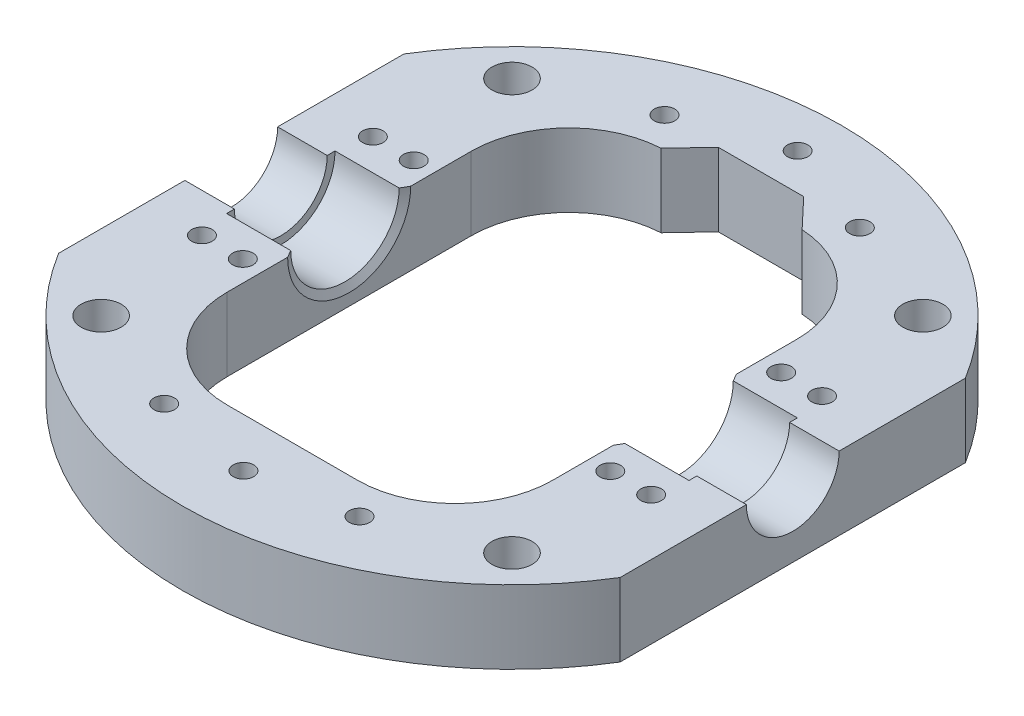
from build123d import *
from OCP.BRepFilletAPI import BRepFilletAPI_MakeChamfer

# Parameters (mm, degrees)
SKETCH2_R               = 67.5
SKETCH2_W               = 66.7
SKETCH2_H               = 90
BOSS_EXTRUDE1_DEPTH     = 15
SKETCH7_W               = 14
SKETCH7_H               = 11.1
CUT_EXTRUDE1_DEPTH      = 135.058839694
CUT_EXTRUDE1_DEPTH_BACK = 135.058839694
SKETCH8_R               = 9.5
FILLET1_R               = 20
SKETCH9_R               = 2.1
CUT_EXTRUDE2_DEPTH      = 97.630740606
CHAMFER1_SIZE           = 1.5
CHAMFER1_SIZE2          = 0.866025404
SKETCH10_R              = 4.1
CUT_EXTRUDE3_DEPTH      = 97.630740606
CUT_EXTRUDE4_DEPTH      = 97.630740606
SKETCH12_W              = 10
SKETCH12_H              = 6
CUT_EXTRUDE5_DEPTH      = 97.630740606
CHAMFER2_START          = -1
CHAMFER2_DEPTH          = 16
CUT_EXTRUDE6_DEPTH      = 97.630740606


with BuildPart() as part:
    # Sketch2 → Boss-Extrude1 (new body)
    with BuildSketch(Plane(origin=(0, 0, 0), x_dir=(1, 0, 0), z_dir=(0, 1, 0))):
        with Locations(Location((0, 0, 0), (0, 0, 270))):
            Circle(SKETCH2_R)
        Rectangle(SKETCH2_W, SKETCH2_H, mode=Mode.SUBTRACT)
    extrude(amount=BOSS_EXTRUDE1_DEPTH)

    # Sketch7 → Cut-Revolve2 (revolve, cut)
    with BuildSketch(Plane(origin=(0, 15, 0), x_dir=(1, 0, 0), z_dir=(0, 1, 0))):
        with Locations((-40.35, 5.55)):
            Rectangle(SKETCH7_W, SKETCH7_H)
        with Locations((40.35, 5.55)):
            Rectangle(SKETCH7_W, SKETCH7_H)
    revolve(axis=Axis((67.5, 15, 0), (-1, 0, 0)), mode=Mode.SUBTRACT)

    # Sketch8 → Cut-Extrude1 (cut, two sides: drawn at the far end of the back side and taken through both)
    with BuildSketch(Plane.ZY.offset(-47.35).offset(-CUT_EXTRUDE1_DEPTH_BACK)):
        with Locations((0, 15)):
            Circle(SKETCH8_R)
    extrude(amount=CUT_EXTRUDE1_DEPTH + CUT_EXTRUDE1_DEPTH_BACK, mode=Mode.SUBTRACT)

    # Fillet1
    fillet1_edges = [part.edges().sort_by_distance(p)[0] for p in [
        (-33.35, 7.5, -45),
        (-33.35, 7.5, 45),
        (33.35, 7.5, 45),
        (33.35, 7.5, -45),
    ]]
    fillet(fillet1_edges, radius=FILLET1_R)

    # Sketch9 → Cut-Extrude2 (cut, through all)
    with BuildSketch(Plane(origin=(0, 15, 0), x_dir=(1, 0, 0), z_dir=(0, 1, 0))):
        with Locations(Location((-37.629775444, 17.5, 0), (0, 0, 270))):
            Circle(SKETCH9_R)
        with Locations(Location((37.629775444, 17.5, 0), (0, 0, 270))):
            Circle(SKETCH9_R)
        with Locations(Location((37.629775444, -17.5, 0), (0, 0, 270))):
            Circle(SKETCH9_R)
        with Locations(Location((-37.629775444, -17.5, 0), (0, 0, 270))):
            Circle(SKETCH9_R)
        with Locations(Location((-20, 51.23475383, 0), (0, 0, 270))):
            Circle(SKETCH9_R)
        with Locations(Location((20, 51.23475383, 0), (0, 0, 270))):
            Circle(SKETCH9_R)
        with Locations(Location((20, -51.23475383, 0), (0, 0, 270))):
            Circle(SKETCH9_R)
        with Locations(Location((-20, -51.23475383, 0), (0, 0, 270))):
            Circle(SKETCH9_R)
        with Locations(Location((0, -55, 0), (0, 0, 270))):
            Circle(SKETCH9_R)
        with Locations(Location((0, 58.5, 0), (0, 0, 270))):
            Circle(SKETCH9_R)
        with Locations(Location((-46, 17.5, 0), (0, 0, 270))):
            Circle(SKETCH9_R)
        with Locations(Location((46, 17.5, 0), (0, 0, 270))):
            Circle(SKETCH9_R)
        with Locations(Location((46, -17.5, 0), (0, 0, 270))):
            Circle(SKETCH9_R)
        with Locations(Location((-46, -17.5, 0), (0, 0, 270))):
            Circle(SKETCH9_R)
    extrude(amount=-CUT_EXTRUDE2_DEPTH, mode=Mode.SUBTRACT)

    # Chamfer1: one chamfer whose edges measure the first distance from different faces: ONE call of the kernel's chamfer builder (chamfer() names one face for all edges)
    chamfer1_edges_1 = [part.edges().sort_by_distance(p)[0] for p in [
        (-33.35, 3.9, 0),
    ]]
    chamfer1_side_1 = [part.faces().sort_by_distance(p)[0] for p in [
        (-33.35, 0.522015325, 0),
    ]]
    chamfer1_edges_2 = [part.edges().sort_by_distance(p)[0] for p in [
        (33.35, 3.9, 0),
    ]]
    chamfer1_side_2 = [part.faces().sort_by_distance(p)[0] for p in [
        (33.35, 0.522015325, 0),
    ]]
    chamfer1 = BRepFilletAPI_MakeChamfer(part.part.solid().wrapped)
    for e in chamfer1_edges_1:
        chamfer1.Add(CHAMFER1_SIZE, CHAMFER1_SIZE2, e.wrapped, chamfer1_side_1[0].wrapped)  # the first distance lies on this face
    for e in chamfer1_edges_2:
        chamfer1.Add(CHAMFER1_SIZE, CHAMFER1_SIZE2, e.wrapped, chamfer1_side_2[0].wrapped)  # the first distance lies on this face
    add(Compound.cast(chamfer1.Shape()), mode=Mode.REPLACE)

    # Sketch10 → Cut-Extrude3 (cut, through all)
    with BuildSketch(Plane.XZ):
        with Locations(Location((42.072853481, -42.072853481, 0), (0, 0, 270))):
            Circle(SKETCH10_R)
        with Locations(Location((-42.072853481, -42.072853481, 0), (0, 0, 270))):
            Circle(SKETCH10_R)
        with Locations(Location((-42.072853481, 42.072853481, 0), (0, 0, 270))):
            Circle(SKETCH10_R)
        with Locations(Location((42.072853481, 42.072853481, 0), (0, 0, 270))):
            Circle(SKETCH10_R)
    extrude(amount=-CUT_EXTRUDE3_DEPTH, mode=Mode.SUBTRACT)

    # Sketch11 → Cut-Extrude4 (cut, through all)
    with BuildSketch(Plane.XZ):
        with BuildLine():
            Line((57.5, -35.355339059), (57.5, 35.355339059))
            ThreePointArc((57.5, 35.355339059), (67.5, 0), (57.5, -35.355339059))
        make_face()
    extrude(amount=-CUT_EXTRUDE4_DEPTH, mode=Mode.SUBTRACT)

    # Sketch12 → Cut-Extrude5 (cut, through all)
    with BuildSketch(Plane(origin=(0, 15, 0), x_dir=(1, 0, 0), z_dir=(0, 1, 0))):
        with Locations((0, 48)):
            Rectangle(SKETCH12_W, SKETCH12_H)
    extrude(amount=-CUT_EXTRUDE5_DEPTH, mode=Mode.SUBTRACT)

    # Chamfer2: read off the stored shape, not the designer's step
    # Chamfer2 outline → Chamfer2 (cut)
    with BuildSketch(Plane(origin=(0, 0, 0), x_dir=(1, 0, 0), z_dir=(0, 1, 0)).offset(CHAMFER2_START)):
        with BuildLine():
            Line((14.45, 44.969727089), (8.74275335, 51))
            Line((8.74275335, 51), (5, 51))
            Line((5, 51), (5, 45))
            Line((5, 45), (13.35, 45))
            ThreePointArc((13.35, 45), (13.900208244, 44.99243034), (14.45, 44.969727089))
        make_face()
        with BuildLine():
            Line((-5, 45), (-5, 51))
            Line((-5, 51), (-8.74275335, 51))
            Line((-8.74275335, 51), (-14.45, 44.969727089))
            ThreePointArc((-14.45, 44.969727089), (-13.900208244, 44.99243034), (-13.35, 45))
            Line((-13.35, 45), (-5, 45))
        make_face()
    extrude(amount=CHAMFER2_DEPTH, mode=Mode.SUBTRACT)

    # Sketch13 → Cut-Extrude6 (cut, through all)
    with BuildSketch(Plane.XZ):
        with BuildLine():
            Line((-57.5, -35.355339059), (-57.5, 35.355339059))
            ThreePointArc((-57.5, 35.355339059), (-67.5, 0), (-57.5, -35.355339059))
        make_face()
    extrude(amount=-CUT_EXTRUDE6_DEPTH, mode=Mode.SUBTRACT)


solid = part.part
